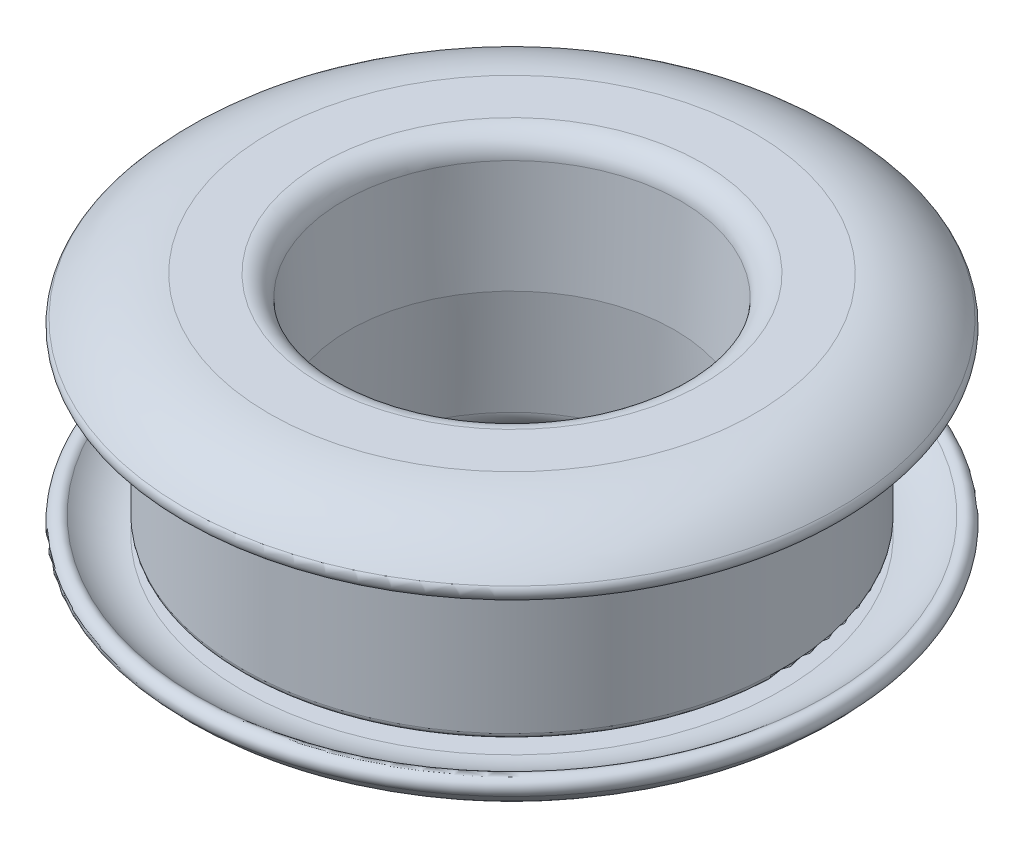
from build123d import *

# Parameters (mm, degrees)
FILLET1_R            = 0.635
FILLET1_OF_MIRROR1_R = 0.635


with BuildPart() as part:
    # Sketch1 → Revolve1 (revolve)
    with BuildSketch(Plane.XY):
        with BuildLine():
            Line((18.404077614, 0), (19.05, 12.324933329))
            ThreePointArc((19.05, 12.324933329), (19.838098396, 14.034450902), (21.586519018, 14.732))
            Line((21.586519018, 14.732), (27.444472362, 14.732))
            ThreePointArc((27.444472362, 14.732), (32.717428763, 13.570821522), (37.014861646, 10.302109959))
            ThreePointArc((37.014861646, 10.302109959), (36.947889799, 8.915600581), (35.56, 8.89))
            ThreePointArc((35.56, 8.89), (33.201001894, 10.336963958), (30.48, 10.841667293))
            Line((30.48, 10.841667293), (24.820547676, 10.841667293))
            ThreePointArc((24.820547676, 10.841667293), (23.131050599, 10.119833647), (24.820547676, 9.398))
            Line((24.820547676, 9.398), (30.48, 9.398))
            Line((30.48, 9.398), (30.48, 0))
            Line((30.48, 0), (18.404077614, 0))
        make_face()
    revolve1 = revolve(axis=Axis((0, 0, 0), (0, 1, 0)))

    # Fillet1
    fillet1_edges = [part.edges().sort_by_distance(p)[0] for p in [
        (-30.48, 9.398, 0),
    ]]
    fillet(fillet1_edges, radius=FILLET1_R)

    # Mirror1: Revolve1 across plane
    add(revolve1.mirror(Plane.ZX))

    # Fillet1 of Mirror1
    fillet1_of_mirror1_edges = [part.edges().sort_by_distance(p)[0] for p in [
        (-30.48, -9.398, 0),
    ]]
    fillet(fillet1_of_mirror1_edges, radius=FILLET1_OF_MIRROR1_R)


solid = part.part
